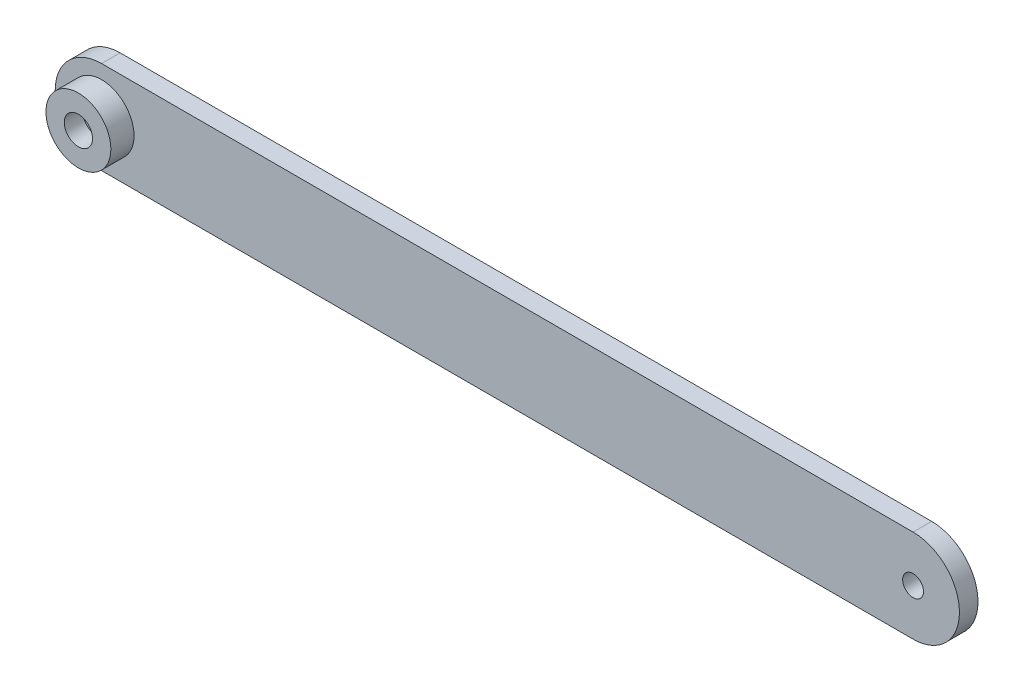
from build123d import *

# Parameters (mm, degrees)
SKETCH1_R           = 2.2500000000000093
SKETCH1_R_2         = 1
BOSS_EXTRUDE1_DEPTH = 2
SKETCH2_R           = 2.5
CUT_EXTRUDE1_DEPTH  = 3
SKETCH4_R           = 7
SKETCH4_R_2         = 1
BOSS_EXTRUDE2_DEPTH = 1
SKETCH5_R           = 7
SKETCH5_R_2         = 3.05
BOSS_EXTRUDE3_DEPTH = 4
BOSS_EXTRUDE4_DEPTH = 3.2
CIRPATTERN2_COUNT   = 21


with BuildPart() as part:
    # Sketch1 → Boss-Extrude1 (new, symmetric)
    with BuildSketch(Plane.XY):
        with BuildLine():
            Line((0, 9.999999999999998), (175, 9.999999999999998))
            ThreePointArc((175, 9.999999999999998), (185, 0), (175, -9.999999999999998))
            Line((175, -9.999999999999998), (0, -9.999999999999998))
            ThreePointArc((0, -9.999999999999998), (-9.999999999999998, 1.22e-15), (0, 9.999999999999998))
        make_face()
        with Locations((174.99999999998468, 8.876163e-11)):
            Circle(SKETCH1_R, mode=Mode.SUBTRACT)
        with Locations((8.09834642054e-06, -5.59837422601e-06)):
            Circle(SKETCH1_R_2, mode=Mode.SUBTRACT)
    extrude(amount=BOSS_EXTRUDE1_DEPTH, both=True)

    # Sketch2 → Cut-Extrude1 (cut)
    with BuildSketch(Plane(origin=(0, 0, -2), x_dir=(-1, 0, 0), z_dir=(0, 0, -1))):
        with Locations((-8.09834642054e-06, -5.59837422601e-06)):
            Circle(SKETCH2_R)
    extrude(amount=-CUT_EXTRUDE1_DEPTH, mode=Mode.SUBTRACT)

    # Sketch4 → Boss-Extrude2 (add)
    with BuildSketch(Plane.XY.offset(2)):
        with Locations((8.09834642054e-06, -5.59837422601e-06)):
            Circle(SKETCH4_R)
        with Locations((8.09834642054e-06, -5.59837422601e-06)):
            Circle(SKETCH4_R_2, mode=Mode.SUBTRACT)
    extrude(amount=BOSS_EXTRUDE2_DEPTH)

    # Sketch5 → Boss-Extrude3 (add)
    with BuildSketch(Plane.XY.offset(3)):
        with Locations((8.09834642054e-06, -5.59837422601e-06)):
            Circle(SKETCH5_R)
        with Locations((8.09834642054e-06, -5.59837422601e-06)):
            Circle(SKETCH5_R_2, mode=Mode.SUBTRACT)
    extrude(amount=BOSS_EXTRUDE3_DEPTH)

    # Sketch6 → Boss-Extrude4 (add)
    with BuildSketch(Plane(origin=(0, 0, -2), x_dir=(-1, 0, 0), z_dir=(0, 0, -1))):
        with BuildLine():
            Line((2.4720706173419296, 0.3726003157826172), (2.1499919016535793, -5.59837422601e-06))
            Line((2.1499919016535793, -5.59837422601e-06), (2.4720706173419296, -0.3726003157826172))
            ThreePointArc((2.4720706173419296, -0.3726003157826172), (2.499991901647451, -6.252921459e-08), (2.4720706173419296, 0.3726003157826172))
        make_face()
    boss_extrude4 = extrude(amount=-BOSS_EXTRUDE4_DEPTH)

    # CirPattern2: Boss-Extrude4 ×21 about axis
    cirpattern2_axis = Axis((8.098346420543079e-06, -5.5983742260068414e-06, 1.0), (0, 0, -1))
    for i in range(1, CIRPATTERN2_COUNT):
        add(boss_extrude4.rotate(cirpattern2_axis, i * 360 / CIRPATTERN2_COUNT))


solid = part.part
